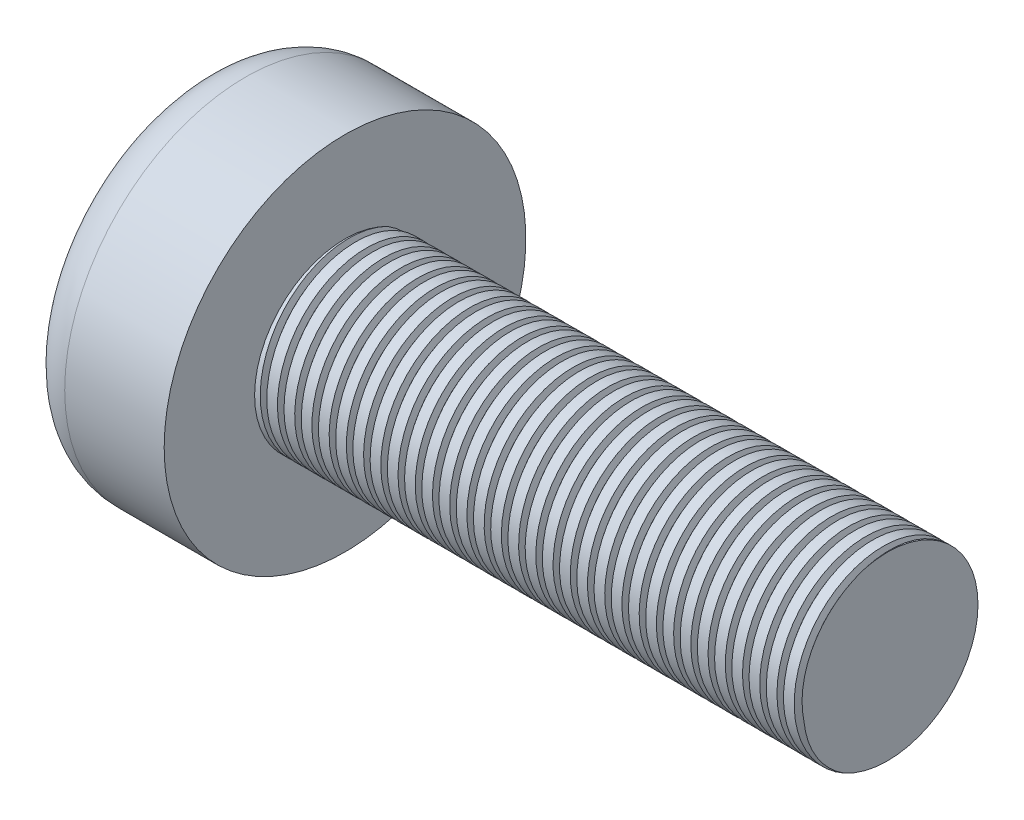
from build123d import *

# Parameters (mm, degrees)
ENL_VEMENT_DE_MATI_RE_BALAYAGE2_PITCH = 0.228571429
ENL_VEMENT_DE_MATI_RE_BALAYAGE2_TO    = 7.2
ENL_V_MAT_EXTRU_1_DEPTH               = 0.6


with BuildPart() as part:
    # Esquisse1 → Révolution1 (revolve)
    with BuildSketch(Plane.XY, mode=Mode.PRIVATE) as r_volution1_sk:
        with BuildLine():
            Line((1.92, 2.4), (0.6, 2.4))
            ThreePointArc((0.6, 2.4), (0.175735931, 2.224264069), (0, 1.8))
            Line((0, 1.8), (0, 0))
            Line((0, 0), (1.92, 0))
            Line((1.92, 0), (9.12, 0))
            Line((9.12, 0), (9.12, 1.2))
            Line((9.12, 1.2), (1.92, 1.2))
            Line((1.92, 1.2), (1.92, 2.4))
        make_face()
    revolve(r_volution1_sk.sketch.rotate(Axis((1.92, 0, 0), (1, 0, 0)), 90), axis=Axis((1.92, 0, 0), (1, 0, 0)))

    # Enlèvement de matière-Balayage2: arcs per turn and ends read off the stored shape
    # Enlèvement de matière-Balayage2: the profile of Esquisse9 screwed along a right-hand helix through 33 turns, 6 arcs to a turn; built about Z, then put on its axis
    enl_vement_de_mati_re_balayage2_z = Axis((0, 0, 0), (0, 0, 1))
    enl_vement_de_mati_re_balayage2_corners = [(1.223434184, 0.00197127, -0.293597161), (1.125836674, -0.000178794, -0.22267359), (1.23608526, -0.001664887, -0.173652264)]
    with BuildLine(mode=Mode.PRIVATE) as enl_vement_de_mati_re_balayage2_profile:
        Line(enl_vement_de_mati_re_balayage2_corners[0], enl_vement_de_mati_re_balayage2_corners[1])
        Line(enl_vement_de_mati_re_balayage2_corners[1], enl_vement_de_mati_re_balayage2_corners[2])
        Line(enl_vement_de_mati_re_balayage2_corners[2], enl_vement_de_mati_re_balayage2_corners[0])
    enl_vement_de_mati_re_balayage2_cap = Face(enl_vement_de_mati_re_balayage2_profile.wire())
    enl_vement_de_mati_re_balayage2_turn_angles = [0, 30, 60, 90, 120, 150, 180, 210, 240, 270, 300, 330, 360]
    enl_vement_de_mati_re_balayage2_turn_weights = [1, 0.8660254037844387, 1, 0.8660254037844387, 1, 0.8660254037844387, 1, 0.8660254037844387, 1, 0.8660254037844387, 1, 0.8660254037844387, 1]
    enl_vement_de_mati_re_balayage2_turn_rails = [Edge.make_bspline([Vector(p[0], p[1], 0).rotate(enl_vement_de_mati_re_balayage2_z, enl_vement_de_mati_re_balayage2_turn_angles[k]) / enl_vement_de_mati_re_balayage2_turn_weights[k] + Vector(0, 0, p[2] + ENL_VEMENT_DE_MATI_RE_BALAYAGE2_PITCH * enl_vement_de_mati_re_balayage2_turn_angles[k] / 360) for k in range(13)], [0, 0, 0, 1, 1, 2, 2, 3, 3, 4, 4, 5, 5, 6, 6, 6], 2, enl_vement_de_mati_re_balayage2_turn_weights) for p in enl_vement_de_mati_re_balayage2_corners]
    enl_vement_de_mati_re_balayage2_turn_sides = [Face.make_surface_from_curves(enl_vement_de_mati_re_balayage2_turn_rails[p[0]], enl_vement_de_mati_re_balayage2_turn_rails[p[1]]) for p in [(0, 1), (1, 2), (2, 0)]]
    enl_vement_de_mati_re_balayage2 = Plane(origin=(9.12, 0, 0), x_dir=(0, 0, 1), z_dir=(-1, 0, 0)) * split(Solid(Shell([*[p.moved(Location((0, 0, ENL_VEMENT_DE_MATI_RE_BALAYAGE2_PITCH * i))) for i in range(33) for p in enl_vement_de_mati_re_balayage2_turn_sides], enl_vement_de_mati_re_balayage2_cap, enl_vement_de_mati_re_balayage2_cap.rotate(enl_vement_de_mati_re_balayage2_z, 11880).moved(Location((0, 0, ENL_VEMENT_DE_MATI_RE_BALAYAGE2_PITCH * 11880 / 360)))])), bisect_by=Plane.XY.offset(ENL_VEMENT_DE_MATI_RE_BALAYAGE2_TO), keep=Keep.BOTTOM, mode=Mode.PRIVATE)
    add(enl_vement_de_mati_re_balayage2, mode=Mode.SUBTRACT)

    # Esquisse10 → Enlèv. mat.-Extru.1 (cut)
    with BuildSketch(Plane(origin=(0, 0, 0), x_dir=(0, 0, -1), z_dir=(1, 0, 0))):
        Polygon((0.378, 1.404), (-0.378, 1.404), (-0.378, 0.378), (-1.404, 0.378), (-1.404, -0.378), (-0.378, -0.37829473), (-0.378, -1.404), (0.378, -1.404), (0.378, -0.37829473), (1.404, -0.378), (1.404, 0.378), (0.378, 0.378), align=None)
    extrude(amount=ENL_V_MAT_EXTRU_1_DEPTH, mode=Mode.SUBTRACT)


solid = part.part
